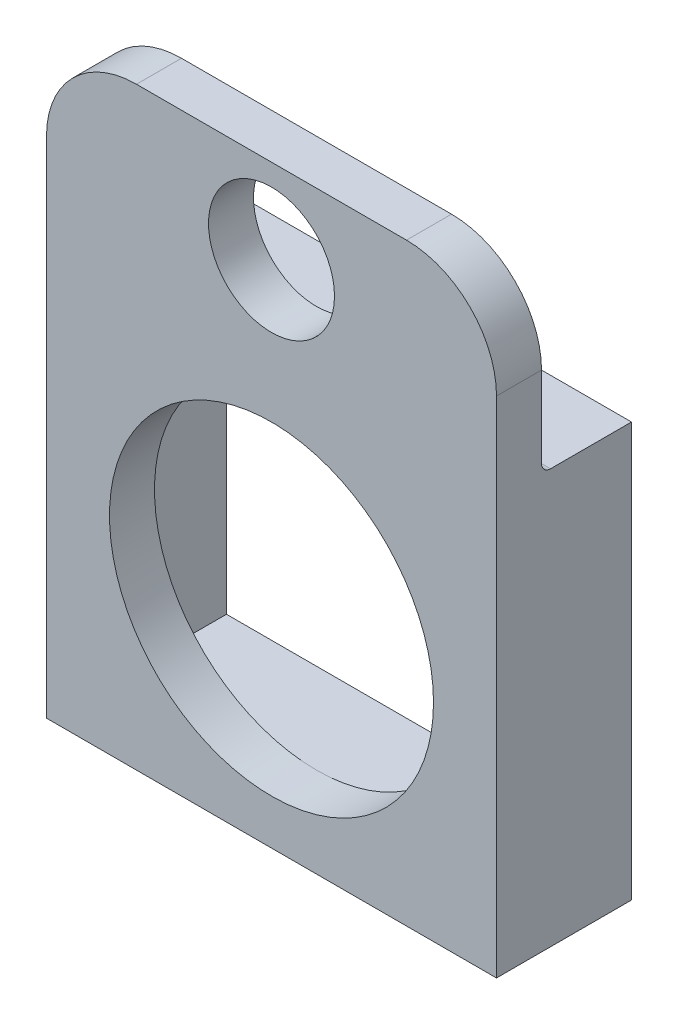
from build123d import *

# Parameters (mm, degrees)
SKETCH1_W           = 50
SKETCH1_H           = 46
BOSS_EXTRUDE1_DEPTH = 15
SHELL1_T            = -5
SKETCH2_R           = 18
CUT_EXTRUDE1_DEPTH  = 5
SKETCH6_W           = 50
SKETCH6_H           = 5
BOSS_EXTRUDE4_DEPTH = 20
FILLET2_R           = 10
SKETCH7_R           = 7
CUT_EXTRUDE5_DEPTH  = 20
FILLET3_R           = 1


with BuildPart() as part:
    # Sketch1 → Boss-Extrude1 (new body)
    with BuildSketch(Plane.XY):
        with Locations((2.887323944, 17.563380282)):
            Rectangle(SKETCH1_W, SKETCH1_H)
    extrude(amount=BOSS_EXTRUDE1_DEPTH)

    # Shell1
    shell1_openings = [part.faces().sort_by_distance(p)[0] for p in [
        (2.887323944, 17.563380282, 0),
    ]]
    offset(amount=SHELL1_T, openings=shell1_openings, kind=Kind.INTERSECTION)

    # Sketch2 → Cut-Extrude1 (cut)
    with BuildSketch(Plane.XY.offset(15)):
        with Locations((2.887323944, 17.563380282)):
            Circle(SKETCH2_R)
    extrude(amount=-CUT_EXTRUDE1_DEPTH, mode=Mode.SUBTRACT)

    # Sketch6 → Boss-Extrude4 (add)
    with BuildSketch(Plane(origin=(0, 40.563380282, 0), x_dir=(1, 0, 0), z_dir=(0, 1, 0))):
        with Locations((2.887323944, -12.5)):
            Rectangle(SKETCH6_W, SKETCH6_H)
    extrude(amount=BOSS_EXTRUDE4_DEPTH)

    # Fillet2
    fillet2_edges = [part.edges().sort_by_distance(p)[0] for p in [
        (-22.112676056, 60.563380282, 12.5),
        (27.887323944, 60.563380282, 12.5),
    ]]
    fillet(fillet2_edges, radius=FILLET2_R)

    # Sketch7 → Cut-Extrude5 (cut)
    with BuildSketch(Plane.XY.offset(15)):
        with Locations((2.887323944, 51.173779733)):
            Circle(SKETCH7_R)
    extrude(amount=-CUT_EXTRUDE5_DEPTH, mode=Mode.SUBTRACT)

    # Fillet3
    fillet3_edges = [part.edges().sort_by_distance(p)[0] for p in [
        (2.887323944, 40.563380282, 10),
    ]]
    fillet(fillet3_edges, radius=FILLET3_R)


solid = part.part
